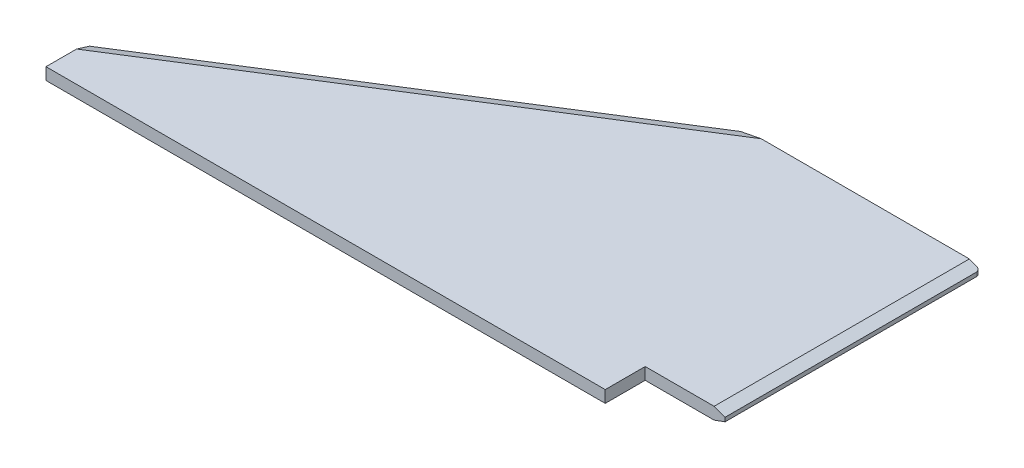
from build123d import *
from OCP.BRepFilletAPI import BRepFilletAPI_MakeChamfer

# Parameters (mm, degrees)
BOSS_EXTRUDE1_DEPTH = 3
CHAMFER1_SIZE       = 1
CHAMFER1_SIZE2      = 2.747477419
CHAMFER2_SIZE       = 1
CHAMFER2_SIZE2      = 2.747477419
FILLET1_R           = 1
SKETCH2_W           = 20
SKETCH2_H           = 10
CUT_EXTRUDE1_DEPTH  = 10


with BuildPart() as part:
    # Sketch1 → Boss-Extrude1 (new body)
    with BuildSketch(Plane(origin=(0, 0, 0), x_dir=(1, 0, 0), z_dir=(0, 1, 0))):
        Polygon((0, 0), (0, 10.9), (100, 73.9), (160, 73.9), (160, 10.9), (160, 0), (152.5, 0), (149, 0), align=None)
    extrude(amount=BOSS_EXTRUDE1_DEPTH)

    # Chamfer1: one chamfer whose edges measure the first distance from different faces: ONE call of the kernel's chamfer builder (chamfer() names one face for all edges)
    chamfer1_edges_1 = [part.edges().sort_by_distance(p)[0] for p in [
        (160, 3, -36.95),
    ]]
    chamfer1_side_1 = [part.faces().sort_by_distance(p)[0] for p in [
        (160, 1.5, -36.95),
    ]]
    chamfer1_edges_2 = [part.edges().sort_by_distance(p)[0] for p in [
        (50, 3, -42.4),
    ]]
    chamfer1_side_2 = [part.faces().sort_by_distance(p)[0] for p in [
        (50, 1.5, -42.4),
    ]]
    chamfer1 = BRepFilletAPI_MakeChamfer(part.part.solid().wrapped)
    for e in chamfer1_edges_1:
        chamfer1.Add(CHAMFER1_SIZE, CHAMFER1_SIZE2, e.wrapped, chamfer1_side_1[0].wrapped)  # the first distance lies on this face
    for e in chamfer1_edges_2:
        chamfer1.Add(CHAMFER1_SIZE, CHAMFER1_SIZE2, e.wrapped, chamfer1_side_2[0].wrapped)  # the first distance lies on this face
    add(Compound.cast(chamfer1.Shape()), mode=Mode.REPLACE)

    # Chamfer2: one chamfer whose edges measure the first distance from different faces: ONE call of the kernel's chamfer builder (chamfer() names one face for all edges)
    chamfer2_edges_1 = [part.edges().sort_by_distance(p)[0] for p in [
        (50, 0, -42.4),
    ]]
    chamfer2_side_1 = [part.faces().sort_by_distance(p)[0] for p in [
        (50, 1, -42.4),
    ]]
    chamfer2_edges_2 = [part.edges().sort_by_distance(p)[0] for p in [
        (160, 0, -36.95),
    ]]
    chamfer2_side_2 = [part.faces().sort_by_distance(p)[0] for p in [
        (160, 1, -36.95),
    ]]
    chamfer2 = BRepFilletAPI_MakeChamfer(part.part.solid().wrapped)
    for e in chamfer2_edges_1:
        chamfer2.Add(CHAMFER2_SIZE, CHAMFER2_SIZE2, e.wrapped, chamfer2_side_1[0].wrapped)  # the first distance lies on this face
    for e in chamfer2_edges_2:
        chamfer2.Add(CHAMFER2_SIZE, CHAMFER2_SIZE2, e.wrapped, chamfer2_side_2[0].wrapped)  # the first distance lies on this face
    add(Compound.cast(chamfer2.Shape()), mode=Mode.REPLACE)

    # Fillet1
    fillet1_edges = [part.edges().sort_by_distance(p)[0] for p in [
        (160, 1.5, -73.9),
    ]]
    fillet(fillet1_edges, radius=FILLET1_R)

    # Sketch2 → Cut-Extrude1 (cut)
    with BuildSketch(Plane(origin=(0, 3, 0), x_dir=(1, 0, 0), z_dir=(0, 1, 0))):
        with Locations((150, 5)):
            Rectangle(SKETCH2_W, SKETCH2_H)
    extrude(amount=-CUT_EXTRUDE1_DEPTH, mode=Mode.SUBTRACT)


solid = part.part
